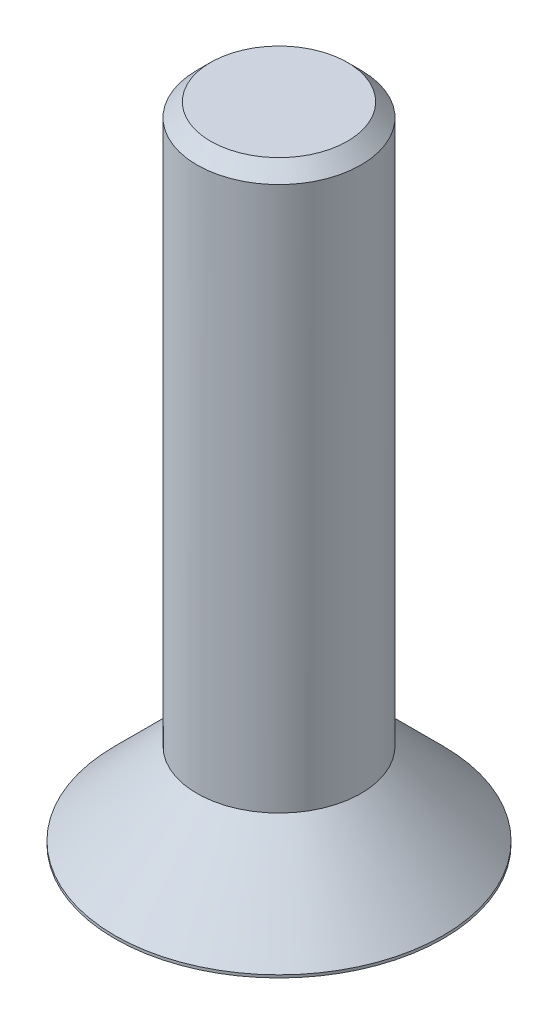
from build123d import *

# Parameters (mm, degrees)
SKETCH1_R           = 3
BOSS_EXTRUDE1_DEPTH = 1.75
SKETCH2_R           = 1.5
BOSS_EXTRUDE2_DEPTH = 10
CHAMFER1_SIZE       = 1.7
CHAMFER2_SIZE       = 0.25


with BuildPart() as part:
    # Sketch1 → Boss-Extrude1 (new body)
    with BuildSketch(Plane(origin=(0, 0, 0), x_dir=(1, 0, 0), z_dir=(0, 1, 0))):
        with Locations(Location((0, 0, 0), (0, 0, 270))):
            Circle(SKETCH1_R)
    extrude(amount=BOSS_EXTRUDE1_DEPTH)

    # Sketch2 → Boss-Extrude2 (add)
    with BuildSketch(Plane(origin=(0, 1.75, 0), x_dir=(1, 0, 0), z_dir=(0, 1, 0))):
        with Locations(Location((0, 0, 0), (0, 0, 270))):
            Circle(SKETCH2_R)
    extrude(amount=BOSS_EXTRUDE2_DEPTH)

    # Chamfer1
    # the kernel refuses this chamfer: 1.7 mm, written as the material it takes off along each edge
    with BuildSketch(Plane(origin=(0, 1.75, 0), x_dir=(0, 0, 1), z_dir=(-1, 0, 0))) as chamfer1_piece_1_section:
        Polygon((3, -CHAMFER1_SIZE), (3 - CHAMFER1_SIZE, 0), (3, 0), align=None)
    chamfer1_piece_1 = revolve(axis=Axis((0, 1.75, 0), (0, 1, 0)), mode=Mode.PRIVATE)
    chamfer1_piece_1 = chamfer1_piece_1 - Plane(origin=(0, 0.796367942, 0), x_dir=(0, 0, 1), z_dir=(0, -1, 0)) * Cylinder(1.5, 12, mode=Mode.PRIVATE)
    add(chamfer1_piece_1, mode=Mode.SUBTRACT)

    # Chamfer2
    chamfer2_edges = [part.edges().sort_by_distance(p)[0] for p in [
        (0, 11.75, -1.5),
    ]]
    chamfer(chamfer2_edges, length=CHAMFER2_SIZE)


solid = part.part
